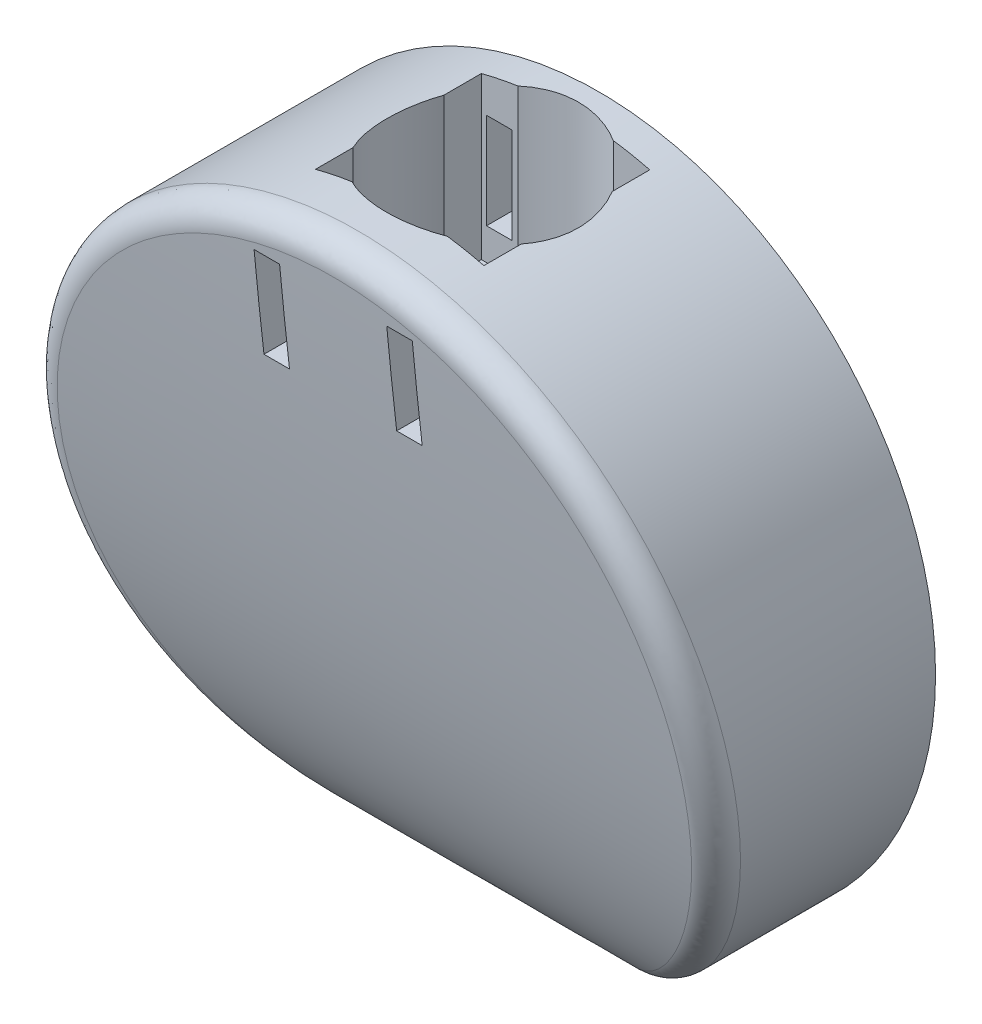
from build123d import *

# Parameters (mm, degrees)
ESQUISSE1_R                  = 67.000000112
BOSS_EXTRU_1_DEPTH           = 53.34
ENL_V_MAT_EXTRU_1_DEPTH      = 110.092762836
ENL_V_MAT_EXTRU_1_DEPTH_BACK = 110.092762836
CONG_1_R                     = 5
ENL_V_MAT_EXTRU_4_DEPTH      = 34.29
ESQUISSE7_R                  = 3.302
ENL_V_MAT_EXTRU_5_DEPTH      = 63.5
ESQUISSE10_W                 = 5.08
ESQUISSE10_H                 = 19.05
ENL_V_MAT_EXTRU_7_DEPTH      = 106.962329583
SYM_TRIE2_COPY_1_SKETCH_W    = 5.08
SYM_TRIE2_COPY_1_SKETCH_H    = 19.05
SYM_TRIE2_COPY_1_DEPTH       = 106.962329583


with BuildPart() as part:
    # Esquisse1 → Boss.-Extru.1 (new body)
    with BuildSketch(Plane.XY):
        with Locations((0.290695021, 0.290695021)):
            Circle(ESQUISSE1_R)
    extrude(amount=BOSS_EXTRU_1_DEPTH)

    # Esquisse4 → Enlèv. mat.-Extru.1 (cut, two sides: drawn at the far end of the back side and taken through both)
    with BuildSketch(Plane(origin=(0, 0, 0), x_dir=(0, 0, -1), z_dir=(1, 0, 0)).offset(-ENL_V_MAT_EXTRU_1_DEPTH_BACK)):
        with BuildLine():
            Line((-0.142164152, -67.127156989), (-53.34, -66.709305091))
            Line((-53.34, -66.709305091), (-53.34, 67.290695133))
            add(Edge.make_bspline(
                [(-53.34, 67.290695133), (-53.314901524, 64.965334409), (-44.651911328, -34.890273822), (-23.160447153, -66.373438876), (-0.142164152, -67.127156989)],
                knots=[0, 0, 0, 0, 0.3629696, 1, 1, 1, 1], degree=3))
        make_face()
    extrude(amount=ENL_V_MAT_EXTRU_1_DEPTH + ENL_V_MAT_EXTRU_1_DEPTH_BACK, mode=Mode.SUBTRACT)

    # Congé1
    cong_1_edges = [part.edges().sort_by_distance(p)[0] for p in [
        (-66.598538996, -3.560329145, 44.401259726),
    ]]
    fillet(cong_1_edges, radius=CONG_1_R)

    # Esquisse6 → Enlèv. mat.-Extru.4 (cut)
    with BuildSketch(Plane(origin=(0, 67.290695133, 0), x_dir=(1, 0, 0), z_dir=(0, 1, 0))):
        with BuildLine():
            Line((-16.783304867, -6.35), (-9.523114629, -6.35))
            ThreePointArc((-9.523114629, -6.35), (-0.019304867, -3.81), (9.484504896, -6.35))
            Line((9.484504896, -6.35), (16.744695133, -6.35))
            Line((16.744695133, -6.35), (16.744695133, -13.81175133))
            ThreePointArc((16.744695133, -13.81175133), (19.030695133, -22.86), (16.744695133, -31.90824867))
            Line((16.744695133, -31.90824867), (16.744695133, -39.37))
            Line((16.744695133, -39.37), (9.484504896, -39.37))
            ThreePointArc((9.484504896, -39.37), (-0.019304867, -41.91), (-9.523114629, -39.37))
            Line((-9.523114629, -39.37), (-16.783304867, -39.37))
            Line((-16.783304867, -39.37), (-16.783304867, -31.90824867))
            ThreePointArc((-16.783304867, -31.90824867), (-19.069304867, -22.86), (-16.783304867, -13.81175133))
            Line((-16.783304867, -13.81175133), (-16.783304867, -6.35))
        make_face()
    extrude(amount=-ENL_V_MAT_EXTRU_4_DEPTH, mode=Mode.SUBTRACT)

    # Esquisse7 → Enlèv. mat.-Extru.5 (cut)
    with BuildSketch(Plane(origin=(0, 67.290695133, 0), x_dir=(1, 0, 0), z_dir=(0, 1, 0))):
        with Locations((-0.019304867, -22.86)):
            Circle(ESQUISSE7_R)
    extrude(amount=-ENL_V_MAT_EXTRU_5_DEPTH, mode=Mode.SUBTRACT)

    # Esquisse10 → Enlèv. mat.-Extru.7 (cut, through all)
    with BuildSketch(Plane.XY.offset(6.35)):
        with Locations((-13.206114629, 48.875695133)):
            Rectangle(ESQUISSE10_W, ESQUISSE10_H)
    enl_v_mat_extru_7 = extrude(amount=-ENL_V_MAT_EXTRU_7_DEPTH, mode=Mode.SUBTRACT)

    # Symétrie1: Enlèv. mat.-Extru.7 across plane
    add(enl_v_mat_extru_7.mirror(Plane(origin=(0, 0, 0), x_dir=(0, 0, 1), z_dir=(1, 0, 0))), mode=Mode.SUBTRACT)

    # Symétrie2: Enlèv. mat.-Extru.7 across plane
    add(enl_v_mat_extru_7.mirror(Plane(origin=(0, 0, 22.859072449), x_dir=(1, 0, 0), z_dir=(0, 0, -1))), mode=Mode.SUBTRACT)

    # Symétrie2 copy 1 sketch → Symétrie2 copy 1 (cut, through all)
    with BuildSketch(Plane(origin=(0, 0, 39.368144898), x_dir=(-1, 0, 0), z_dir=(0, 0, -1))):
        with Locations((-13.206114629, 48.875695133)):
            Rectangle(SYM_TRIE2_COPY_1_SKETCH_W, SYM_TRIE2_COPY_1_SKETCH_H)
    extrude(amount=-SYM_TRIE2_COPY_1_DEPTH, mode=Mode.SUBTRACT)


solid = part.part
